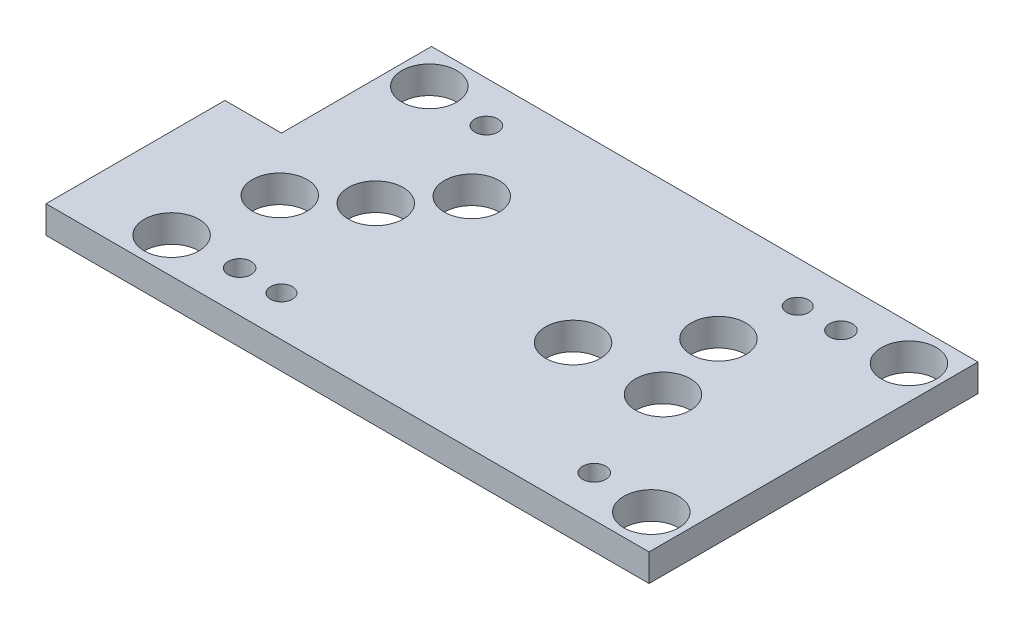
from build123d import *

# Parameters (mm, degrees)
SKETCH1_W             = 220
SKETCH1_H             = 120
BOSS_EXTRUDE1_DEPTH   = 10
CUT_EXTRUDE1_REACH    = 127.698
SKETCH2_W             = 20.632503002
SKETCH2_H             = 54.730004003
CUT_EXTRUDE2_REACH    = 127.698
SKETCH3_R             = 10
F_8_0MM_DOWEL_HOLE1_D = 8
M8_CLEARANCE_HOLE1_D  = 8.4


with BuildPart() as part:
    # Sketch1 → Boss-Extrude1 (new body)
    with BuildSketch(Plane(origin=(0, 0, 0), x_dir=(1, 0, 0), z_dir=(0, 1, 0))):
        Rectangle(SKETCH1_W, SKETCH1_H)
    extrude(amount=-BOSS_EXTRUDE1_DEPTH)

    # Sketch2 → Cut-Extrude1 (cut, up to next)
    with BuildSketch(Plane(origin=(0, 0, 0), x_dir=(1, 0, 0), z_dir=(0, 1, 0)), mode=Mode.PRIVATE) as cut_extrude1_sk1:
        with Locations((-99.683748499, 32.634997999)):
            Rectangle(SKETCH2_W, SKETCH2_H)
    cut_extrude1_tool1 = extrude(cut_extrude1_sk1.sketch, amount=-CUT_EXTRUDE1_REACH, mode=Mode.PRIVATE) & part.part
    add(cut_extrude1_tool1.solids().sort_by_distance((-99.683748, 0, -32.634998))[0], mode=Mode.SUBTRACT)

    # Sketch3 → Cut-Extrude2 (cut, up to next)
    with BuildSketch(Plane(origin=(0, 0, 0), x_dir=(1, 0, 0), z_dir=(0, 1, 0)), mode=Mode.PRIVATE) as cut_extrude2_sk1:
        with Locations((97.816251501, -47)):
            Circle(SKETCH3_R)
    cut_extrude2_tool1 = extrude(cut_extrude2_sk1.sketch, amount=-CUT_EXTRUDE2_REACH, mode=Mode.PRIVATE) & part.part
    # Sketch3 → Cut-Extrude2 (cut, up to next)
    with BuildSketch(Plane(origin=(0, 0, 0), x_dir=(1, 0, 0), z_dir=(0, 1, 0)), mode=Mode.PRIVATE) as cut_extrude2_sk2:
        with Locations((-77.183748499, -47)):
            Circle(SKETCH3_R)
    cut_extrude2_tool2 = extrude(cut_extrude2_sk2.sketch, amount=-CUT_EXTRUDE2_REACH, mode=Mode.PRIVATE) & part.part
    # Sketch3 → Cut-Extrude2 (cut, up to next)
    with BuildSketch(Plane(origin=(0, 0, 0), x_dir=(1, 0, 0), z_dir=(0, 1, 0)), mode=Mode.PRIVATE) as cut_extrude2_sk3:
        with Locations((-70, -14.72)):
            Circle(SKETCH3_R)
    cut_extrude2_tool3 = extrude(cut_extrude2_sk3.sketch, amount=-CUT_EXTRUDE2_REACH, mode=Mode.PRIVATE) & part.part
    # Sketch3 → Cut-Extrude2 (cut, up to next)
    with BuildSketch(Plane(origin=(0, 0, 0), x_dir=(1, 0, 0), z_dir=(0, 1, 0)), mode=Mode.PRIVATE) as cut_extrude2_sk4:
        with Locations((-50, 0.28)):
            Circle(SKETCH3_R)
    cut_extrude2_tool4 = extrude(cut_extrude2_sk4.sketch, amount=-CUT_EXTRUDE2_REACH, mode=Mode.PRIVATE) & part.part
    # Sketch3 → Cut-Extrude2 (cut, up to next)
    with BuildSketch(Plane(origin=(0, 0, 0), x_dir=(1, 0, 0), z_dir=(0, 1, 0)), mode=Mode.PRIVATE) as cut_extrude2_sk5:
        with Locations((30, -7.72)):
            Circle(SKETCH3_R)
    cut_extrude2_tool5 = extrude(cut_extrude2_sk5.sketch, amount=-CUT_EXTRUDE2_REACH, mode=Mode.PRIVATE) & part.part
    # Sketch3 → Cut-Extrude2 (cut, up to next)
    with BuildSketch(Plane(origin=(0, 0, 0), x_dir=(1, 0, 0), z_dir=(0, 1, 0)), mode=Mode.PRIVATE) as cut_extrude2_sk6:
        with Locations((62.816251501, -7.72)):
            Circle(SKETCH3_R)
    cut_extrude2_tool6 = extrude(cut_extrude2_sk6.sketch, amount=-CUT_EXTRUDE2_REACH, mode=Mode.PRIVATE) & part.part
    # Sketch3 → Cut-Extrude2 (cut, up to next)
    with BuildSketch(Plane(origin=(0, 0, 0), x_dir=(1, 0, 0), z_dir=(0, 1, 0)), mode=Mode.PRIVATE) as cut_extrude2_sk7:
        with Locations((55.316251501, 20)):
            Circle(SKETCH3_R)
    cut_extrude2_tool7 = extrude(cut_extrude2_sk7.sketch, amount=-CUT_EXTRUDE2_REACH, mode=Mode.PRIVATE) & part.part
    # Sketch3 → Cut-Extrude2 (cut, up to next)
    with BuildSketch(Plane(origin=(0, 0, 0), x_dir=(1, 0, 0), z_dir=(0, 1, 0)), mode=Mode.PRIVATE) as cut_extrude2_sk8:
        with Locations((97.816251501, 47)):
            Circle(SKETCH3_R)
    cut_extrude2_tool8 = extrude(cut_extrude2_sk8.sketch, amount=-CUT_EXTRUDE2_REACH, mode=Mode.PRIVATE) & part.part
    # Sketch3 → Cut-Extrude2 (cut, up to next)
    with BuildSketch(Plane(origin=(0, 0, 0), x_dir=(1, 0, 0), z_dir=(0, 1, 0)), mode=Mode.PRIVATE) as cut_extrude2_sk9:
        with Locations((-34.683748499, 20)):
            Circle(SKETCH3_R)
    cut_extrude2_tool9 = extrude(cut_extrude2_sk9.sketch, amount=-CUT_EXTRUDE2_REACH, mode=Mode.PRIVATE) & part.part
    # Sketch3 → Cut-Extrude2 (cut, up to next)
    with BuildSketch(Plane(origin=(0, 0, 0), x_dir=(1, 0, 0), z_dir=(0, 1, 0)), mode=Mode.PRIVATE) as cut_extrude2_sk10:
        with Locations((-77.183748499, 47)):
            Circle(SKETCH3_R)
    cut_extrude2_tool10 = extrude(cut_extrude2_sk10.sketch, amount=-CUT_EXTRUDE2_REACH, mode=Mode.PRIVATE) & part.part
    add(cut_extrude2_tool1.solids().sort_by_distance((97.816252, 0, 47))[0], mode=Mode.SUBTRACT)
    add(cut_extrude2_tool2.solids().sort_by_distance((-77.183748, 0, 47))[0], mode=Mode.SUBTRACT)
    add(cut_extrude2_tool3.solids().sort_by_distance((-70, 0, 14.72))[0], mode=Mode.SUBTRACT)
    add(cut_extrude2_tool4.solids().sort_by_distance((-50, 0, -0.28))[0], mode=Mode.SUBTRACT)
    add(cut_extrude2_tool5.solids().sort_by_distance((30, 0, 7.72))[0], mode=Mode.SUBTRACT)
    add(cut_extrude2_tool6.solids().sort_by_distance((62.816252, 0, 7.72))[0], mode=Mode.SUBTRACT)
    add(cut_extrude2_tool7.solids().sort_by_distance((55.316252, 0, -20))[0], mode=Mode.SUBTRACT)
    add(cut_extrude2_tool8.solids().sort_by_distance((97.816252, 0, -47))[0], mode=Mode.SUBTRACT)
    add(cut_extrude2_tool9.solids().sort_by_distance((-34.683748, 0, -20))[0], mode=Mode.SUBTRACT)
    add(cut_extrude2_tool10.solids().sort_by_distance((-77.183748, 0, -47))[0], mode=Mode.SUBTRACT)

    # Ø8.0mm Dowel Hole1 (through all)
    with Locations(Plane(origin=(0, 0, 0), x_dir=(1, 0, 0), z_dir=(0, 1, 0))):
        with Locations((-38.867496998, -45.241024981), (59.5, 44.728378806)):
            Hole(F_8_0MM_DOWEL_HOLE1_D / 2)

    # M8 Clearance Hole1 (through all)
    with Locations(Plane(origin=(0, 0, 0), x_dir=(1, 0, 0), z_dir=(0, 1, 0))):
        with Locations((-54.367496998, 45), (75, 45), (75, -45), (-54.367496998, -45)):
            Hole(M8_CLEARANCE_HOLE1_D / 2)


solid = part.part
